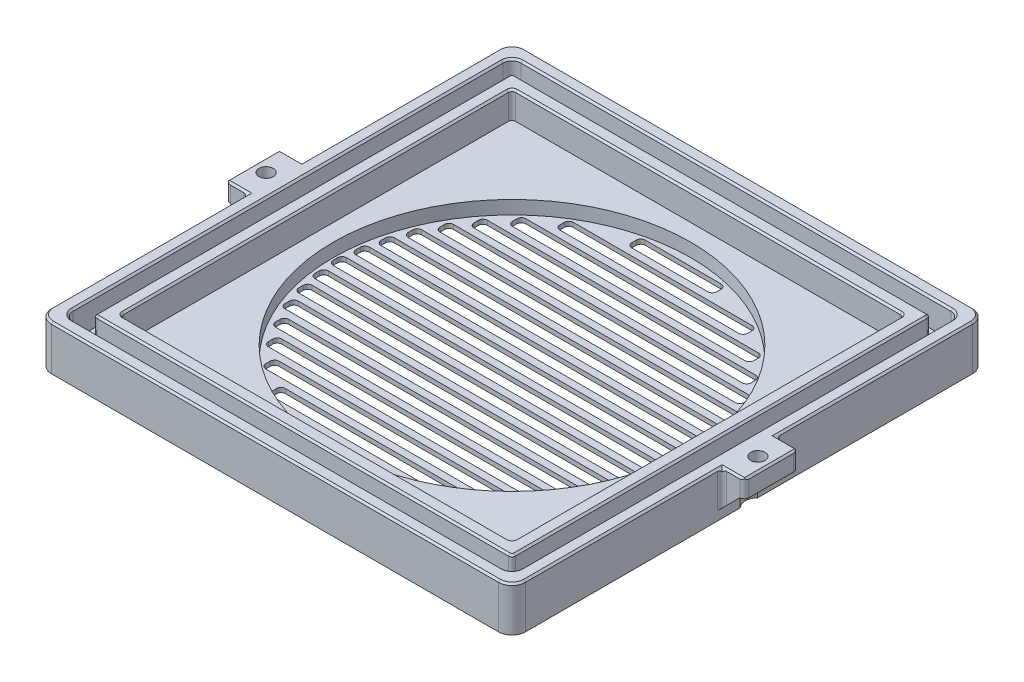
from build123d import *

# Parameters (mm, degrees)
SKETCH_1_W               = 106
SKETCH_1_H               = 106
EXTRUDE_1_DEPTH          = 10
SKETCH_2_W               = 100.2
SKETCH_2_H               = 100.2
SKETCH_2_W_2             = 93.6
SKETCH_2_H_2             = 93.6
CUT_EXTRUDE_1_DEPTH      = 6
SKETCH_3_W               = 87.6
SKETCH_3_H               = 87.6
CUT_EXTRUDE_3_DEPTH      = 6
SKETCH_4_R               = 40
CUT_EXTRUDE_4_DEPTH      = 3
FILLET_1_R               = 2
FILLET_2_R               = 3
FILLET_3_R               = 0.8
SKETCH_6_W               = 5
SKETCH_6_H               = 12
EXTRUDE_3_DEPTH          = 4
CHAMFER_1_SIZE           = 0.4
CHAMFER_2_SIZE           = 4
CUT_EXTRUDE_6_DEPTH      = 154.600130208
CUT_EXTRUDE_6_DEPTH_BACK = 4
SKETCH_7_R               = 1.6
SKETCH_8_R               = 2.8
CUT_EXTRUDE_7_DEPTH      = 154.600130208
FILLET_4_R               = 1
SKETCH_9_W               = 79
SKETCH_9_H               = 3
SKETCH_9_W_2             = 78
SKETCH_9_W_3             = 76
SKETCH_9_W_4             = 73
SKETCH_9_W_5             = 68
SKETCH_9_W_6             = 62
SKETCH_9_W_7             = 54
SKETCH_9_W_8             = 42
SKETCH_9_W_9             = 19
CUT_EXTRUDE_8_DEPTH      = 10
FILLET_5_R               = 1


with BuildPart() as part:
    # 草图1 → 凸台-拉伸1 (new body)
    with BuildSketch(Plane(origin=(0, 0, 0), x_dir=(1, 0, 0), z_dir=(0, 1, 0))):
        with Locations((53, 53)):
            Rectangle(SKETCH_1_W, SKETCH_1_H)
    extrude(amount=EXTRUDE_1_DEPTH)

    # 草图2 → 切除-拉伸1 (cut)
    with BuildSketch(Plane(origin=(0, 10, 0), x_dir=(1, 0, 0), z_dir=(0, 1, 0))):
        with Locations((53, 53)):
            Rectangle(SKETCH_2_W, SKETCH_2_H)
        with Locations((53, 53)):
            Rectangle(SKETCH_2_W_2, SKETCH_2_H_2, mode=Mode.SUBTRACT)
    extrude(amount=-CUT_EXTRUDE_1_DEPTH, mode=Mode.SUBTRACT)

    # 草图3 → 切除-拉伸3 (cut)
    with BuildSketch(Plane(origin=(0, 10, 0), x_dir=(1, 0, 0), z_dir=(0, 1, 0))):
        with Locations((53, 53)):
            Rectangle(SKETCH_3_W, SKETCH_3_H)
    extrude(amount=-CUT_EXTRUDE_3_DEPTH, mode=Mode.SUBTRACT)

    # 草图4 → 切除-拉伸4 (cut)
    with BuildSketch(Plane(origin=(0, 4, 0), x_dir=(-1, 0, 0), z_dir=(0, -1, 0))):
        with Locations((-53, 53)):
            Circle(SKETCH_4_R)
    extrude(amount=CUT_EXTRUDE_4_DEPTH, mode=Mode.SUBTRACT)

    # 圆角1
    fillet_1_edges = [part.edges().sort_by_distance(p)[0] for p in [
        (103.1, 7, -103.1),
        (2.9, 7, -103.1),
        (2.9, 7, -2.9),
        (103.1, 7, -2.9),
    ]]
    fillet(fillet_1_edges, radius=FILLET_1_R)

    # 圆角2
    fillet_2_edges = [part.edges().sort_by_distance(p)[0] for p in [
        (106, 5, -106),
        (0, 5, -106),
        (0, 5, 0),
        (106, 5, 0),
    ]]
    fillet(fillet_2_edges, radius=FILLET_2_R)

    # 圆角3
    fillet_3_edges = [part.edges().sort_by_distance(p)[0] for p in [
        (99.8, 7, -99.8),
        (6.2, 7, -99.8),
        (6.2, 7, -6.2),
        (99.8, 7, -6.2),
        (9.2, 7, -9.2),
        (9.2, 7, -96.8),
        (96.8, 7, -96.8),
        (96.8, 7, -9.2),
    ]]
    fillet(fillet_3_edges, radius=FILLET_3_R)

    # 草图6 → 凸台-拉伸3 (add)
    with BuildSketch(Plane(origin=(0, 10, 0), x_dir=(1, 0, 0), z_dir=(0, 1, 0))):
        with Locations((-2.5, 53)):
            Rectangle(SKETCH_6_W, SKETCH_6_H)
        with Locations((108.5, 53)):
            Rectangle(SKETCH_6_W, SKETCH_6_H)
    extrude(amount=-EXTRUDE_3_DEPTH)

    # 倒角1
    chamfer_1_edges = [part.edges().sort_by_distance(p)[0] for p in [
        (105.121320344, 10, -0.878679656),
        (53, 10, 0),
        (0.878679656, 10, -0.878679656),
        (0, 10, -25),
        (0, 10, -81),
        (0.878679656, 10, -105.121320344),
        (53, 10, -106),
        (105.121320344, 10, -105.121320344),
        (106, 10, -81),
        (106, 10, -25),
        (3.485786438, 10, -3.485786438),
        (53, 10, -2.9),
        (102.514213562, 10, -3.485786438),
        (103.1, 10, -53),
        (102.514213562, 10, -102.514213562),
        (53, 10, -103.1),
        (3.485786438, 10, -102.514213562),
        (2.9, 10, -53),
        (99.565685425, 10, -6.434314575),
        (53, 10, -6.2),
        (6.434314575, 10, -6.434314575),
        (6.2, 10, -53),
        (6.434314575, 10, -99.565685425),
        (53, 10, -99.8),
        (99.565685425, 10, -99.565685425),
        (99.8, 10, -53),
        (9.434314575, 10, -96.565685425),
        (9.2, 10, -53),
        (9.434314575, 10, -9.434314575),
        (53, 10, -9.2),
        (96.565685425, 10, -9.434314575),
        (96.8, 10, -53),
        (96.565685425, 10, -96.565685425),
        (53, 10, -96.8),
        (-2.5, 10, -47),
        (-5, 10, -53),
        (-2.5, 10, -59),
        (108.5, 10, -59),
        (111, 10, -53),
        (108.5, 10, -47),
    ]]
    chamfer(chamfer_1_edges, length=CHAMFER_1_SIZE)

    # 倒角2
    chamfer_2_edges = [part.edges().sort_by_distance(p)[0] for p in [
        (106, 6, -53),
        (0, 6, -53),
    ]]
    chamfer(chamfer_2_edges, length=CHAMFER_2_SIZE)

    # 草图7 → 切除-拉伸6 (cut, two sides: drawn at the far end of the back side and taken through both)
    with BuildSketch(Plane(origin=(0, 6, 0), x_dir=(-1, 0, 0), z_dir=(0, -1, 0)).offset(-CUT_EXTRUDE_6_DEPTH_BACK)):
        with Locations((2, 53)):
            Circle(SKETCH_7_R)
        with Locations((-108, 53)):
            Circle(SKETCH_7_R)
    extrude(amount=CUT_EXTRUDE_6_DEPTH + CUT_EXTRUDE_6_DEPTH_BACK, mode=Mode.SUBTRACT)

    # 草图8 → 切除-拉伸7 (cut, through all)
    with BuildSketch(Plane(origin=(0, 6, 0), x_dir=(-1, 0, 0), z_dir=(0, -1, 0))):
        with Locations((2, 53)):
            Circle(SKETCH_8_R)
        with Locations((-108, 53)):
            Circle(SKETCH_8_R)
    extrude(amount=CUT_EXTRUDE_7_DEPTH, mode=Mode.SUBTRACT)

    # 圆角4
    fillet_4_edges = [part.edges().sort_by_distance(p)[0] for p in [
        (106, 5.8, -47),
        (106, 5.8, -59),
        (111, 7.8, -59),
        (111, 7.8, -47),
        (0, 5.8, -47),
        (0, 5.8, -59),
        (-5, 7.8, -47),
        (-5, 7.8, -59),
    ]]
    fillet(fillet_4_edges, radius=FILLET_4_R)

    # 草图9 → 切除-拉伸8 (cut)
    with BuildSketch(Plane(origin=(0, 1, 0), x_dir=(1, 0, 0), z_dir=(0, 1, 0))):
        with Locations((53, 53)):
            Rectangle(SKETCH_9_W, SKETCH_9_H)
        with Locations((53, 57.6)):
            Rectangle(SKETCH_9_W_2, SKETCH_9_H)
        with Locations((53, 62.2)):
            Rectangle(SKETCH_9_W_3, SKETCH_9_H)
        with Locations((53, 66.8)):
            Rectangle(SKETCH_9_W_4, SKETCH_9_H)
        with Locations((53, 71.4)):
            Rectangle(SKETCH_9_W_5, SKETCH_9_H)
        with Locations((53, 76)):
            Rectangle(SKETCH_9_W_6, SKETCH_9_H)
        with Locations((53, 80.6)):
            Rectangle(SKETCH_9_W_7, SKETCH_9_H)
        with Locations((53, 85.2)):
            Rectangle(SKETCH_9_W_8, SKETCH_9_H)
        with Locations((53, 89.8)):
            Rectangle(SKETCH_9_W_9, SKETCH_9_H)
        with Locations((53, 16.2)):
            Rectangle(SKETCH_9_W_9, SKETCH_9_H)
        with Locations((53, 20.8)):
            Rectangle(SKETCH_9_W_8, SKETCH_9_H)
        with Locations((53, 25.4)):
            Rectangle(SKETCH_9_W_7, SKETCH_9_H)
        with Locations((53, 30)):
            Rectangle(SKETCH_9_W_6, SKETCH_9_H)
        with Locations((53, 34.6)):
            Rectangle(SKETCH_9_W_5, SKETCH_9_H)
        with Locations((53, 39.2)):
            Rectangle(SKETCH_9_W_4, SKETCH_9_H)
        with Locations((53, 43.8)):
            Rectangle(SKETCH_9_W_3, SKETCH_9_H)
        with Locations((53, 48.4)):
            Rectangle(SKETCH_9_W_2, SKETCH_9_H)
    extrude(amount=-CUT_EXTRUDE_8_DEPTH, mode=Mode.SUBTRACT)

    # 圆角5
    fillet_5_edges = [part.edges().sort_by_distance(p)[0] for p in [
        (43.5, 0.5, -91.3),
        (62.5, 0.5, -91.3),
        (62.5, 0.5, -88.3),
        (43.5, 0.5, -88.3),
        (32, 0.5, -86.7),
        (74, 0.5, -86.7),
        (74, 0.5, -83.7),
        (32, 0.5, -83.7),
        (26, 0.5, -82.1),
        (80, 0.5, -82.1),
        (80, 0.5, -79.1),
        (26, 0.5, -79.1),
        (22, 0.5, -77.5),
        (84, 0.5, -77.5),
        (84, 0.5, -74.5),
        (22, 0.5, -74.5),
        (19, 0.5, -72.9),
        (87, 0.5, -72.9),
        (87, 0.5, -69.9),
        (19, 0.5, -69.9),
        (16.5, 0.5, -68.3),
        (89.5, 0.5, -68.3),
        (89.5, 0.5, -65.3),
        (16.5, 0.5, -65.3),
        (15, 0.5, -63.7),
        (91, 0.5, -63.7),
        (91, 0.5, -60.7),
        (15, 0.5, -60.7),
        (92, 0.5, -59.1),
        (92, 0.5, -56.1),
        (14, 0.5, -56.1),
        (92.5, 0.5, -54.5),
        (92.5, 0.5, -51.5),
        (13.5, 0.5, -51.5),
        (14, 0.5, -59.1),
        (13.5, 0.5, -54.5),
        (43.5, 0.5, -17.7),
        (62.5, 0.5, -17.7),
        (62.5, 0.5, -14.7),
        (43.5, 0.5, -14.7),
        (32, 0.5, -22.3),
        (74, 0.5, -22.3),
        (74, 0.5, -19.3),
        (32, 0.5, -19.3),
        (26, 0.5, -26.9),
        (80, 0.5, -26.9),
        (80, 0.5, -23.9),
        (26, 0.5, -23.9),
        (22, 0.5, -31.5),
        (84, 0.5, -31.5),
        (84, 0.5, -28.5),
        (22, 0.5, -28.5),
        (19, 0.5, -36.1),
        (87, 0.5, -36.1),
        (87, 0.5, -33.1),
        (19, 0.5, -33.1),
        (16.5, 0.5, -40.7),
        (89.5, 0.5, -40.7),
        (89.5, 0.5, -37.7),
        (16.5, 0.5, -37.7),
        (15, 0.5, -45.3),
        (91, 0.5, -45.3),
        (91, 0.5, -42.3),
        (15, 0.5, -42.3),
        (14, 0.5, -49.9),
        (92, 0.5, -49.9),
        (92, 0.5, -46.9),
        (14, 0.5, -46.9),
    ]]
    fillet(fillet_5_edges, radius=FILLET_5_R)


solid = part.part
